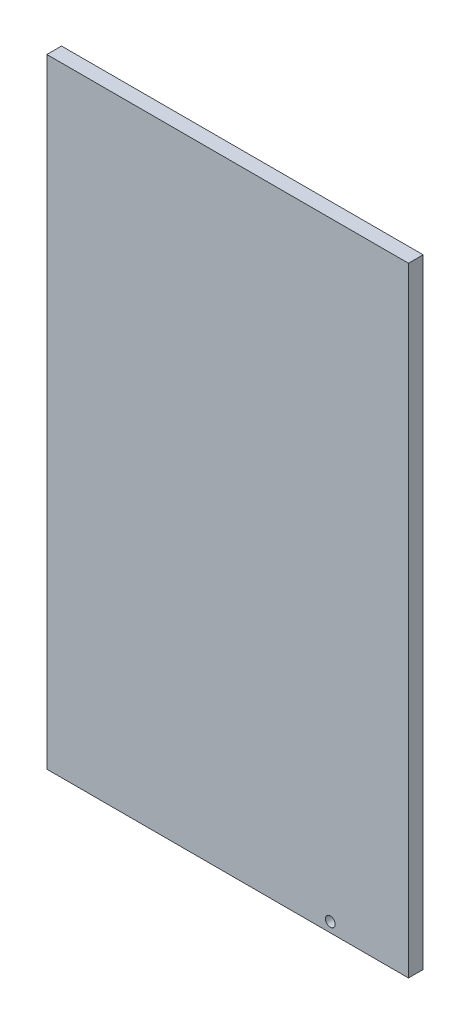
from build123d import *

# Parameters (mm, degrees)
SKETCH1_W           = 222
SKETCH1_H           = 380
BOSS_EXTRUDE1_DEPTH = 9
SKETCH2_R           = 3
CUT_EXTRUDE1_DEPTH  = 221.231696175


with BuildPart() as part:
    # Sketch1 → Boss-Extrude1 (new body)
    with BuildSketch(Plane.XY):
        Rectangle(SKETCH1_W, SKETCH1_H)
    extrude(amount=BOSS_EXTRUDE1_DEPTH)

    # Sketch2 → Cut-Extrude1 (cut, through all)
    with BuildSketch(Plane.XY.offset(9)):
        with Locations((63, -184)):
            Circle(SKETCH2_R)
    extrude(amount=-CUT_EXTRUDE1_DEPTH, mode=Mode.SUBTRACT)


solid = part.part
